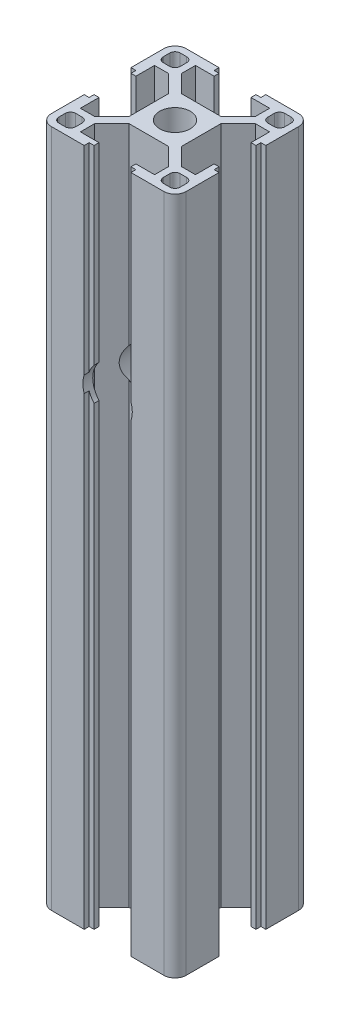
from build123d import *

# Parameters (mm, degrees)
SKETCH1_R               = 3.4
BOSS_EXTRUDE1_DEPTH     = 151
CUT_EXTRUDE2_DEPTH      = 107.454873068
CUT_EXTRUDE2_DEPTH_BACK = 107.454873068
SKETCH2_R               = 3.125
SKETCH2_R_2             = 5.5


with BuildPart() as part:
    # Sketch1 → Boss-Extrude1 (new body)
    with BuildSketch(Plane(origin=(0, 100, 0), x_dir=(1, 0, 0), z_dir=(0, 1, 0))):
        with BuildLine():
            Line((27.5, 0), (20.200000224, 0))
            Line((20.200000224, 0), (20.200000224, -1.1))
            Line((20.200000224, -1.1), (19.1, -1.1))
            Line((19.1, -1.1), (19.1, -2.2))
            Line((19.1, -2.2), (23.249999989, -2.2))
            Line((23.249999989, -2.2), (23.249999989, -5.335786427))
            Line((23.249999989, -5.335786427), (19.385786417, -9.2))
            Line((19.385786417, -9.2), (10.614213562, -9.2))
            Line((10.614213562, -9.2), (6.75, -5.335786438))
            Line((6.75, -5.335786438), (6.75, -2.2))
            Line((6.75, -2.2), (10.9, -2.2))
            Line((10.9, -2.2), (10.9, -1.1))
            Line((10.9, -1.1), (9.799999776, -1.1))
            Line((9.799999776, -1.1), (9.799999776, 0))
            Line((9.799999776, 0), (2.5, 0))
            ThreePointArc((2.5, 0), (0.732233047, -0.732233047), (0, -2.5))
            Line((0, -2.5), (0, -9.799999776))
            Line((0, -9.799999776), (1.1, -9.799999776))
            Line((1.1, -9.799999776), (1.1, -10.9))
            Line((1.1, -10.9), (2.199999979, -10.9))
            Line((2.199999979, -10.9), (2.199999979, -6.750000011))
            Line((2.199999979, -6.750000011), (5.335786427, -6.750000011))
            Line((5.335786427, -6.750000011), (9.199999989, -10.614213573))
            Line((9.199999989, -10.614213573), (9.199999989, -19.385786427))
            Line((9.199999989, -19.385786427), (5.335786417, -23.25))
            Line((5.335786417, -23.25), (2.199999979, -23.25))
            Line((2.199999979, -23.25), (2.199999979, -19.1))
            Line((2.199999979, -19.1), (1.1, -19.1))
            Line((1.1, -19.1), (1.1, -20.200000224))
            Line((1.1, -20.200000224), (0, -20.200000224))
            Line((0, -20.200000224), (0, -27.5))
            ThreePointArc((0, -27.5), (0.732233047, -29.267766953), (2.5, -30))
            Line((2.5, -30), (9.799999776, -30))
            Line((9.799999776, -30), (9.799999776, -28.9))
            Line((9.799999776, -28.9), (10.9, -28.9))
            Line((10.9, -28.9), (10.9, -27.8))
            Line((10.9, -27.8), (6.75, -27.8))
            Line((6.75, -27.8), (6.75, -24.664213562))
            Line((6.75, -24.664213562), (10.614213562, -20.8))
            Line((10.614213562, -20.8), (19.385786417, -20.8))
            Line((19.385786417, -20.8), (23.249999989, -24.664213573))
            Line((23.249999989, -24.664213573), (23.249999989, -27.8))
            Line((23.249999989, -27.8), (19.1, -27.8))
            Line((19.1, -27.8), (19.1, -28.9))
            Line((19.1, -28.9), (20.200000224, -28.9))
            Line((20.200000224, -28.9), (20.200000224, -30))
            Line((20.200000224, -30), (27.5, -30))
            ThreePointArc((27.5, -30), (29.267766953, -29.267766953), (30, -27.5))
            Line((30, -27.5), (30, -20.200000224))
            Line((30, -20.200000224), (28.9, -20.200000224))
            Line((28.9, -20.200000224), (28.9, -19.1))
            Line((28.9, -19.1), (27.799999979, -19.1))
            Line((27.799999979, -19.1), (27.799999979, -23.25))
            Line((27.799999979, -23.25), (24.664213562, -23.25))
            Line((24.664213562, -23.25), (20.799999989, -19.385786427))
            Line((20.799999989, -19.385786427), (20.799999989, -10.614213573))
            Line((20.799999989, -10.614213573), (24.664213552, -6.750000011))
            Line((24.664213552, -6.750000011), (27.799999979, -6.750000011))
            Line((27.799999979, -6.750000011), (27.799999979, -10.9))
            Line((27.799999979, -10.9), (28.9, -10.9))
            Line((28.9, -10.9), (28.9, -9.799999776))
            Line((28.9, -9.799999776), (30, -9.799999776))
            Line((30, -9.799999776), (30, -2.5))
            ThreePointArc((30, -2.5), (29.267766953, -0.732233047), (27.5, 0))
        make_face()
        with Locations((15, -15)):
            Circle(SKETCH1_R, mode=Mode.SUBTRACT)
        with BuildLine():
            Line((28.5, -25.9), (28.5, -27.35))
            ThreePointArc((28.5, -27.35), (28.163172798, -28.163172798), (27.35, -28.5))
            Line((27.35, -28.5), (25.9, -28.5))
            ThreePointArc((25.9, -28.5), (25.086827202, -28.163172798), (24.75, -27.35))
            Line((24.75, -27.35), (24.75, -25.9))
            ThreePointArc((24.75, -25.9), (25.086827202, -25.086827202), (25.9, -24.75))
            Line((25.9, -24.75), (27.35, -24.75))
            ThreePointArc((27.35, -24.75), (28.163172798, -25.086827202), (28.5, -25.9))
        make_face(mode=Mode.SUBTRACT)
        with BuildLine():
            Line((1.5, -27.35), (1.5, -25.9))
            ThreePointArc((1.5, -25.9), (1.836827202, -25.086827202), (2.65, -24.75))
            Line((2.65, -24.75), (4.1, -24.75))
            ThreePointArc((4.1, -24.75), (4.913172798, -25.086827202), (5.25, -25.9))
            Line((5.25, -25.9), (5.25, -27.35))
            ThreePointArc((5.25, -27.35), (4.913172798, -28.163172798), (4.1, -28.5))
            Line((4.1, -28.5), (2.65, -28.5))
            ThreePointArc((2.65, -28.5), (1.836827202, -28.163172798), (1.5, -27.35))
        make_face(mode=Mode.SUBTRACT)
        with BuildLine():
            Line((2.65, -1.5), (4.1, -1.5))
            ThreePointArc((4.1, -1.5), (4.913172798, -1.836827202), (5.25, -2.65))
            Line((5.25, -2.65), (5.25, -4.1))
            ThreePointArc((5.25, -4.1), (4.913172798, -4.913172798), (4.1, -5.25))
            Line((4.1, -5.25), (2.65, -5.25))
            ThreePointArc((2.65, -5.25), (1.836827202, -4.913172798), (1.5, -4.1))
            Line((1.5, -4.1), (1.5, -2.65))
            ThreePointArc((1.5, -2.65), (1.836827202, -1.836827202), (2.65, -1.5))
        make_face(mode=Mode.SUBTRACT)
        with BuildLine():
            Line((28.5, -2.65), (28.5, -4.1))
            ThreePointArc((28.5, -4.1), (28.163172798, -4.913172798), (27.35, -5.25))
            Line((27.35, -5.25), (25.9, -5.25))
            ThreePointArc((25.9, -5.25), (25.086827202, -4.913172798), (24.75, -4.1))
            Line((24.75, -4.1), (24.75, -2.65))
            ThreePointArc((24.75, -2.65), (25.086827202, -1.836827202), (25.9, -1.5))
            Line((25.9, -1.5), (27.35, -1.5))
            ThreePointArc((27.35, -1.5), (28.163172798, -1.836827202), (28.5, -2.65))
        make_face(mode=Mode.SUBTRACT)
    extrude(amount=-BOSS_EXTRUDE1_DEPTH)

    # Sketch2 → Cut-Extrude2 (cut, two sides: drawn at the far end of the back side and taken through both)
    with BuildSketch(Plane.XY.offset(20.8).offset(-CUT_EXTRUDE2_DEPTH_BACK)):
        with Locations((14.999999989, 76.810128201)):
            Circle(SKETCH2_R)
        with Locations((14.999999989, 53.997628201)):
            Circle(SKETCH2_R_2)
        with Locations((14.999999989, 31.185128201)):
            Circle(SKETCH2_R)
    extrude(amount=CUT_EXTRUDE2_DEPTH + CUT_EXTRUDE2_DEPTH_BACK, mode=Mode.SUBTRACT)


solid = part.part
